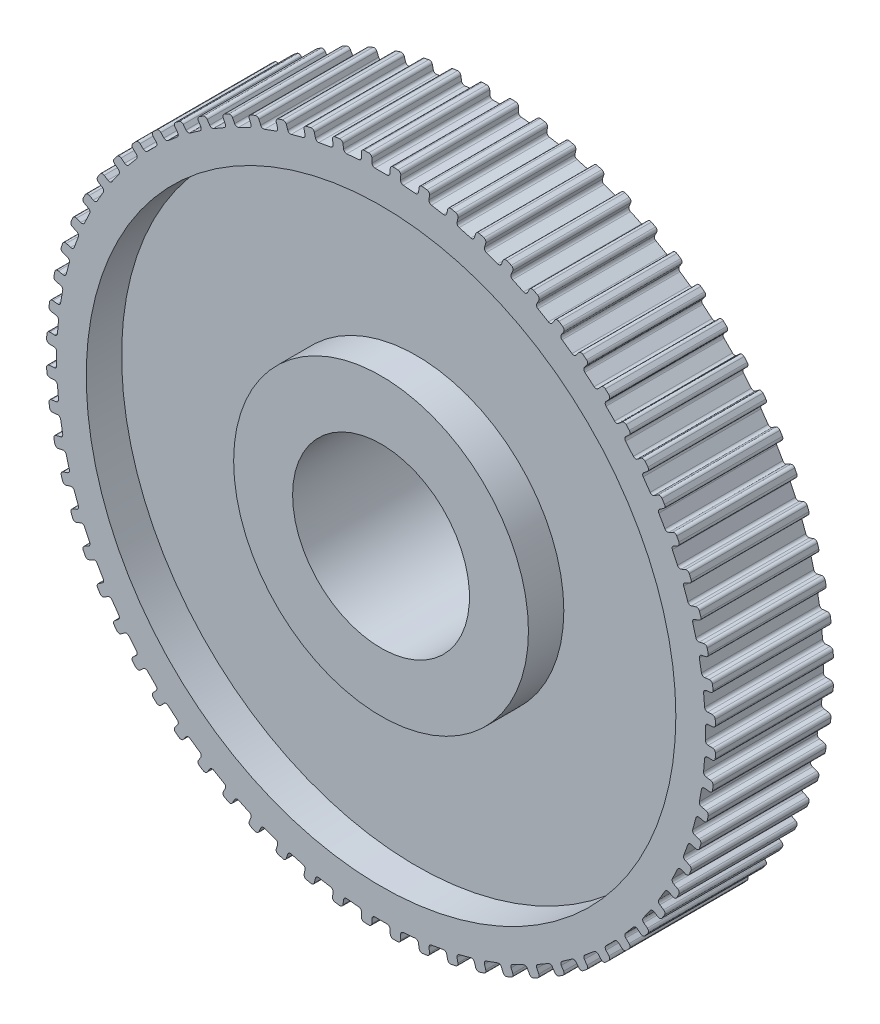
from build123d import *

# Parameters (mm, degrees)
SKETCH1_R                = 56.75
SKETCH1_R_2              = 3.5
BOSS_EXTRUDE1_DEPTH      = 20
SKETCH3_R                = 50
SKETCH3_R_2              = 25
CUT_EXTRUDE1_DEPTH       = 6
SKETCH5_R                = 25
BOSS_EXTRUDE2_DEPTH      = 10
CUT_EXTRUDE2_DEPTH       = 83.711093573
FILLET1_R                = 0.5
FILLET3_R                = 0.5
CIRPATTERN1_COUNT        = 72
FILLET1_OF_CIRPATTERN1_R = 0.5
FILLET3_OF_CIRPATTERN1_R = 0.5
SKETCH7_R                = 3.5
CUT_EXTRUDE3_DEPTH       = 83.659198952
SKETCH8_R                = 15
CUT_EXTRUDE4_DEPTH       = 86.630270182


with BuildPart() as part:
    # Sketch1 → Boss-Extrude1 (new body)
    with BuildSketch(Plane.XY):
        Circle(SKETCH1_R)
        Circle(SKETCH1_R_2, mode=Mode.SUBTRACT)
    extrude(amount=BOSS_EXTRUDE1_DEPTH)

    # Sketch3 → Cut-Extrude1 (cut)
    with BuildSketch(Plane.XY.offset(20)):
        Circle(SKETCH3_R)
        Circle(SKETCH3_R_2, mode=Mode.SUBTRACT)
    cut_extrude1 = extrude(amount=-CUT_EXTRUDE1_DEPTH, mode=Mode.SUBTRACT)

    # Mirror1: Cut-Extrude1 across plane
    add(cut_extrude1.mirror(Plane.XY.offset(10)), mode=Mode.SUBTRACT)

    # Sketch5 → Boss-Extrude2 (add)
    with BuildSketch(Plane(origin=(0, 0, 0), x_dir=(-1, 0, 0), z_dir=(0, 0, -1))):
        Circle(SKETCH5_R)
    extrude(amount=BOSS_EXTRUDE2_DEPTH)

    # Sketch6 → Cut-Extrude2 (cut, through all)
    with BuildSketch(Plane(origin=(0, 0, 0), x_dir=(-1, 0, 0), z_dir=(0, 0, -1))):
        Polygon((55, 1.5), (55, -1.5), (56.966000943, -1.6), (57, 0), (56.966000943, 1.6), align=None)
    cut_extrude2 = extrude(amount=-CUT_EXTRUDE2_DEPTH, mode=Mode.SUBTRACT)

    # Fillet1
    fillet1_edges = [part.edges().sort_by_distance(p)[0] for p in [
        (-56.727780915, -1.587883016, 10),
        (-56.727780915, 1.587883016, 10),
    ]]
    fillet(fillet1_edges, radius=FILLET1_R)

    # Fillet3
    fillet3_edges = [part.edges().sort_by_distance(p)[0] for p in [
        (-55, -1.5, 10),
        (-55, 1.5, 10),
    ]]
    fillet(fillet3_edges, radius=FILLET3_R)

    # CirPattern1: Cut-Extrude2 ×72 about axis
    cirpattern1_axis = Axis((0, 0, 0), (0, 0, 1))
    for i in range(1, CIRPATTERN1_COUNT):
        add(cut_extrude2.rotate(cirpattern1_axis, i * 360 / CIRPATTERN1_COUNT), mode=Mode.SUBTRACT)

    # Fillet1 of CirPattern1
    fillet1_of_cirpattern1_edges = [part.edges().sort_by_distance(p)[0] for p in [
        (-56.373521458, -6.525992521, 10),
        (-56.650307706, -3.362311239, 10),
        (-55.590225464, -11.414435284, 10),
        (-56.141691448, -8.286916274, 10),
        (-54.383854288, -16.216007301, 10),
        (-55.20580302, -13.148452873, 10),
        (-52.763589143, -20.894165711, 10),
        (-53.849765096, -17.909921807, 10),
        (-50.741761225, -25.413306905, 10),
        (-52.083897944, -22.535085421, 10),
        (-48.333757865, -29.739037487, 10),
        (-49.92164088, -26.988743428, 10),
        (-45.557905423, -33.838436038, 10),
        (-47.379449986, -31.237000801, 10),
        (-42.435329812, -37.680303658, 10),
        (-44.476672868, -35.247525737, 10),
        (-38.989795719, -41.235401415, 10),
        (-41.235401415, -38.989795719, 10),
        (-35.247525737, -44.476672868, 10),
        (-37.680303658, -42.435329812, 10),
        (-31.237000801, -47.379449986, 10),
        (-33.838436038, -45.557905423, 10),
        (-26.988743428, -49.92164088, 10),
        (-29.739037487, -48.333757865, 10),
        (-22.535085421, -52.083897944, 10),
        (-25.413306905, -50.741761225, 10),
        (-17.909921807, -53.849765096, 10),
        (-20.894165711, -52.763589143, 10),
        (-13.148452873, -55.20580302, 10),
        (-16.216007301, -54.383854288, 10),
        (-8.286916274, -56.141691448, 10),
        (-11.414435284, -55.590225464, 10),
        (-3.362311239, -56.650307706, 10),
        (-6.525992521, -56.373521458, 10),
        (1.587883016, -56.727780915, 10),
        (-1.587883016, -56.727780915, 10),
        (6.525992521, -56.373521458, 10),
        (3.362311239, -56.650307706, 10),
        (11.414435284, -55.590225464, 10),
        (8.286916274, -56.141691448, 10),
        (16.216007301, -54.383854288, 10),
        (13.148452873, -55.20580302, 10),
        (20.894165711, -52.763589143, 10),
        (17.909921807, -53.849765096, 10),
        (25.413306905, -50.741761225, 10),
        (22.535085421, -52.083897944, 10),
        (29.739037487, -48.333757865, 10),
        (26.988743428, -49.92164088, 10),
        (33.838436038, -45.557905423, 10),
        (31.237000801, -47.379449986, 10),
        (37.680303658, -42.435329812, 10),
        (35.247525737, -44.476672868, 10),
        (41.235401415, -38.989795719, 10),
        (38.989795719, -41.235401415, 10),
        (44.476672868, -35.247525737, 10),
        (42.435329812, -37.680303658, 10),
        (47.379449986, -31.237000801, 10),
        (45.557905423, -33.838436038, 10),
        (49.92164088, -26.988743428, 10),
        (48.333757865, -29.739037487, 10),
        (52.083897944, -22.535085421, 10),
        (50.741761225, -25.413306905, 10),
        (53.849765096, -17.909921807, 10),
        (52.763589143, -20.894165711, 10),
        (55.20580302, -13.148452873, 10),
        (54.383854288, -16.216007301, 10),
        (56.141691448, -8.286916274, 10),
        (55.590225464, -11.414435284, 10),
        (56.650307706, -3.362311239, 10),
        (56.373521458, -6.525992521, 10),
        (56.727780915, 1.587883016, 10),
        (56.727780915, -1.587883016, 10),
        (56.373521458, 6.525992521, 10),
        (56.650307706, 3.362311239, 10),
        (55.590225464, 11.414435284, 10),
        (56.141691448, 8.286916274, 10),
        (54.383854288, 16.216007301, 10),
        (55.20580302, 13.148452873, 10),
        (52.763589143, 20.894165711, 10),
        (53.849765096, 17.909921807, 10),
        (50.741761225, 25.413306905, 10),
        (52.083897944, 22.535085421, 10),
        (48.333757865, 29.739037487, 10),
        (49.92164088, 26.988743428, 10),
        (45.557905423, 33.838436038, 10),
        (47.379449986, 31.237000801, 10),
        (42.435329812, 37.680303658, 10),
        (44.476672868, 35.247525737, 10),
        (38.989795719, 41.235401415, 10),
        (41.235401415, 38.989795719, 10),
        (35.247525737, 44.476672868, 10),
        (37.680303658, 42.435329812, 10),
        (31.237000801, 47.379449986, 10),
        (33.838436038, 45.557905423, 10),
        (26.988743428, 49.92164088, 10),
        (29.739037487, 48.333757865, 10),
        (22.535085421, 52.083897944, 10),
        (25.413306905, 50.741761225, 10),
        (17.909921807, 53.849765096, 10),
        (20.894165711, 52.763589143, 10),
        (13.148452873, 55.20580302, 10),
        (16.216007301, 54.383854288, 10),
        (8.286916274, 56.141691448, 10),
        (11.414435284, 55.590225464, 10),
        (3.362311239, 56.650307706, 10),
        (6.525992521, 56.373521458, 10),
        (-1.587883016, 56.727780915, 10),
        (1.587883016, 56.727780915, 10),
        (-6.525992521, 56.373521458, 10),
        (-3.362311239, 56.650307706, 10),
        (-11.414435284, 55.590225464, 10),
        (-8.286916274, 56.141691448, 10),
        (-16.216007301, 54.383854288, 10),
        (-13.148452873, 55.20580302, 10),
        (-20.894165711, 52.763589143, 10),
        (-17.909921807, 53.849765096, 10),
        (-25.413306905, 50.741761225, 10),
        (-22.535085421, 52.083897944, 10),
        (-29.739037487, 48.333757865, 10),
        (-26.988743428, 49.92164088, 10),
        (-33.838436038, 45.557905423, 10),
        (-31.237000801, 47.379449986, 10),
        (-37.680303658, 42.435329812, 10),
        (-35.247525737, 44.476672868, 10),
        (-41.235401415, 38.989795719, 10),
        (-38.989795719, 41.235401415, 10),
        (-44.476672868, 35.247525737, 10),
        (-42.435329812, 37.680303658, 10),
        (-47.379449986, 31.237000801, 10),
        (-45.557905423, 33.838436038, 10),
        (-49.92164088, 26.988743428, 10),
        (-48.333757865, 29.739037487, 10),
        (-52.083897944, 22.535085421, 10),
        (-50.741761225, 25.413306905, 10),
        (-53.849765096, 17.909921807, 10),
        (-52.763589143, 20.894165711, 10),
        (-55.20580302, 13.148452873, 10),
        (-54.383854288, 16.216007301, 10),
        (-56.141691448, 8.286916274, 10),
        (-55.590225464, 11.414435284, 10),
        (-56.650307706, 3.362311239, 10),
        (-56.373521458, 6.525992521, 10),
    ]]
    fillet(fillet1_of_cirpattern1_edges, radius=FILLET1_OF_CIRPATTERN1_R)

    # Fillet3 of CirPattern1
    fillet3_of_cirpattern1_edges = [part.edges().sort_by_distance(p)[0] for p in [
        (-54.659974781, -6.287857898, 10),
        (-54.921442009, -3.299273804, 10),
        (-53.903954149, -11.027861401, 10),
        (-54.424898682, -8.073438142, 10),
        (-52.737691878, -15.68393622, 10),
        (-53.514149014, -12.786158741, 10),
        (-51.170063928, -20.220646814, 10),
        (-52.196124358, -17.401568952, 10),
        (-49.213000894, -24.603466076, 10),
        (-50.48085568, -21.884542715, 10),
        (-46.881397208, -28.799038106, 10),
        (-48.381397208, -26.200961894, 10),
        (-44.192997781, -32.775432066, 10),
        (-45.91372709, -30.317975933, 10),
        (-41.168262957, -36.502385197, 10),
        (-43.096625786, -34.204251868, 10),
        (-37.830212793, -39.951533137, 10),
        (-39.951533137, -37.830212793, 10),
        (-34.204251868, -43.096625786, 10),
        (-36.502385197, -41.168262957, 10),
        (-30.317975933, -45.91372709, 10),
        (-32.775432066, -44.192997781, 10),
        (-26.200961894, -48.381397208, 10),
        (-28.799038106, -46.881397208, 10),
        (-21.884542715, -50.48085568, 10),
        (-24.603466076, -49.213000894, 10),
        (-17.401568952, -52.196124358, 10),
        (-20.220646814, -51.170063928, 10),
        (-12.786158741, -53.514149014, 10),
        (-15.68393622, -52.737691878, 10),
        (-8.073438142, -54.424898682, 10),
        (-11.027861401, -53.903954149, 10),
        (-3.299273804, -54.921442009, 10),
        (-6.287857898, -54.659974781, 10),
        (1.5, -55, 10),
        (-1.5, -55, 10),
        (6.287857898, -54.659974781, 10),
        (3.299273804, -54.921442009, 10),
        (11.027861401, -53.903954149, 10),
        (8.073438142, -54.424898682, 10),
        (15.68393622, -52.737691878, 10),
        (12.786158741, -53.514149014, 10),
        (20.220646814, -51.170063928, 10),
        (17.401568952, -52.196124358, 10),
        (24.603466076, -49.213000894, 10),
        (21.884542715, -50.48085568, 10),
        (28.799038106, -46.881397208, 10),
        (26.200961894, -48.381397208, 10),
        (32.775432066, -44.192997781, 10),
        (30.317975933, -45.91372709, 10),
        (36.502385197, -41.168262957, 10),
        (34.204251868, -43.096625786, 10),
        (39.951533137, -37.830212793, 10),
        (37.830212793, -39.951533137, 10),
        (43.096625786, -34.204251868, 10),
        (41.168262957, -36.502385197, 10),
        (45.91372709, -30.317975933, 10),
        (44.192997781, -32.775432066, 10),
        (48.381397208, -26.200961894, 10),
        (46.881397208, -28.799038106, 10),
        (50.48085568, -21.884542715, 10),
        (49.213000894, -24.603466076, 10),
        (52.196124358, -17.401568952, 10),
        (51.170063928, -20.220646814, 10),
        (53.514149014, -12.786158741, 10),
        (52.737691878, -15.68393622, 10),
        (54.424898682, -8.073438142, 10),
        (53.903954149, -11.027861401, 10),
        (54.921442009, -3.299273804, 10),
        (54.659974781, -6.287857898, 10),
        (55, 1.5, 10),
        (55, -1.5, 10),
        (54.659974781, 6.287857898, 10),
        (54.921442009, 3.299273804, 10),
        (53.903954149, 11.027861401, 10),
        (54.424898682, 8.073438142, 10),
        (52.737691878, 15.68393622, 10),
        (53.514149014, 12.786158741, 10),
        (51.170063928, 20.220646814, 10),
        (52.196124358, 17.401568952, 10),
        (49.213000894, 24.603466076, 10),
        (50.48085568, 21.884542715, 10),
        (46.881397208, 28.799038106, 10),
        (48.381397208, 26.200961894, 10),
        (44.192997781, 32.775432066, 10),
        (45.91372709, 30.317975933, 10),
        (41.168262957, 36.502385197, 10),
        (43.096625786, 34.204251868, 10),
        (37.830212793, 39.951533137, 10),
        (39.951533137, 37.830212793, 10),
        (34.204251868, 43.096625786, 10),
        (36.502385197, 41.168262957, 10),
        (30.317975933, 45.91372709, 10),
        (32.775432066, 44.192997781, 10),
        (26.200961894, 48.381397208, 10),
        (28.799038106, 46.881397208, 10),
        (21.884542715, 50.48085568, 10),
        (24.603466076, 49.213000894, 10),
        (17.401568952, 52.196124358, 10),
        (20.220646814, 51.170063928, 10),
        (12.786158741, 53.514149014, 10),
        (15.68393622, 52.737691878, 10),
        (8.073438142, 54.424898682, 10),
        (11.027861401, 53.903954149, 10),
        (3.299273804, 54.921442009, 10),
        (6.287857898, 54.659974781, 10),
        (-1.5, 55, 10),
        (1.5, 55, 10),
        (-6.287857898, 54.659974781, 10),
        (-3.299273804, 54.921442009, 10),
        (-11.027861401, 53.903954149, 10),
        (-8.073438142, 54.424898682, 10),
        (-15.68393622, 52.737691878, 10),
        (-12.786158741, 53.514149014, 10),
        (-20.220646814, 51.170063928, 10),
        (-17.401568952, 52.196124358, 10),
        (-24.603466076, 49.213000894, 10),
        (-21.884542715, 50.48085568, 10),
        (-28.799038106, 46.881397208, 10),
        (-26.200961894, 48.381397208, 10),
        (-32.775432066, 44.192997781, 10),
        (-30.317975933, 45.91372709, 10),
        (-36.502385197, 41.168262957, 10),
        (-34.204251868, 43.096625786, 10),
        (-39.951533137, 37.830212793, 10),
        (-37.830212793, 39.951533137, 10),
        (-43.096625786, 34.204251868, 10),
        (-41.168262957, 36.502385197, 10),
        (-45.91372709, 30.317975933, 10),
        (-44.192997781, 32.775432066, 10),
        (-48.381397208, 26.200961894, 10),
        (-46.881397208, 28.799038106, 10),
        (-50.48085568, 21.884542715, 10),
        (-49.213000894, 24.603466076, 10),
        (-52.196124358, 17.401568952, 10),
        (-51.170063928, 20.220646814, 10),
        (-53.514149014, 12.786158741, 10),
        (-52.737691878, 15.68393622, 10),
        (-54.424898682, 8.073438142, 10),
        (-53.903954149, 11.027861401, 10),
        (-54.921442009, 3.299273804, 10),
        (-54.659974781, 6.287857898, 10),
    ]]
    fillet(fillet3_of_cirpattern1_edges, radius=FILLET3_OF_CIRPATTERN1_R)

    # Sketch7 → Cut-Extrude3 (cut, through all)
    with BuildSketch(Plane.XY):
        Circle(SKETCH7_R)
    extrude(amount=-CUT_EXTRUDE3_DEPTH, mode=Mode.SUBTRACT)

    # Sketch8 → Cut-Extrude4 (cut, through all)
    with BuildSketch(Plane(origin=(0, 0, -10), x_dir=(-1, 0, 0), z_dir=(0, 0, -1))):
        Circle(SKETCH8_R)
    extrude(amount=-CUT_EXTRUDE4_DEPTH, mode=Mode.SUBTRACT)


solid = part.part
